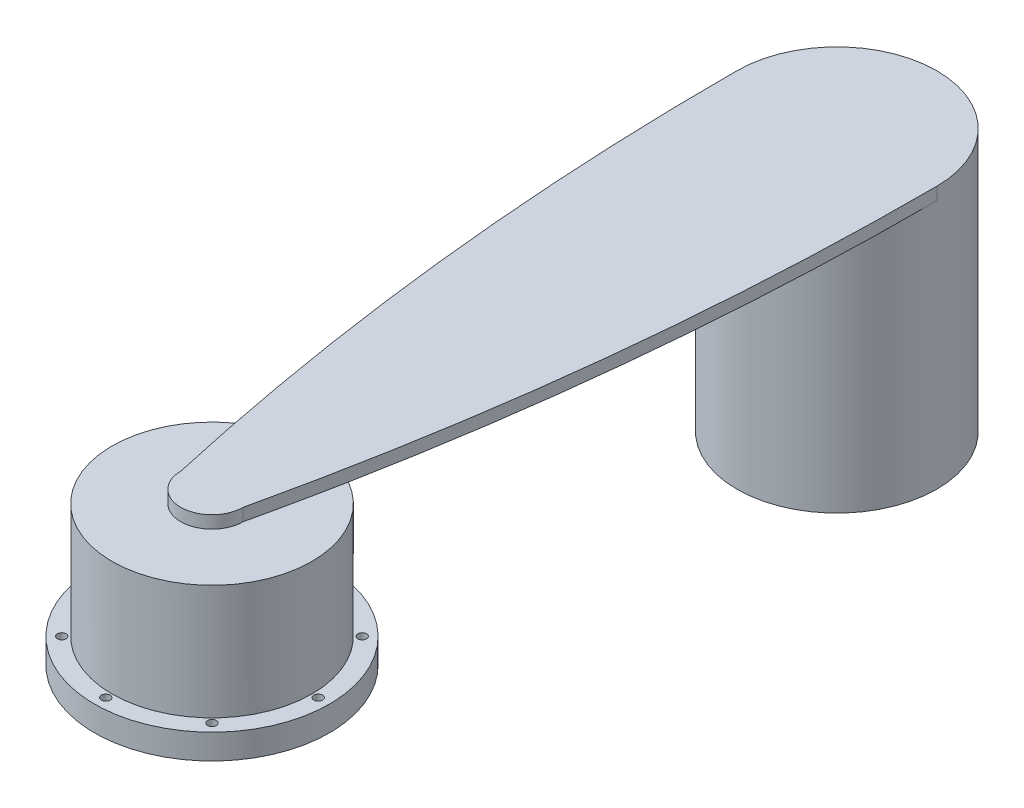
from build123d import *
from build123d.topology import SkipClean

# Parameters (mm, degrees)
SKETCH_1_R          = 40
EXTRUDE_1_DEPTH     = 50
EXTRUDE_1_2_DEPTH   = 50
EXTRUDE_START       = 5
EXTRUDE_2_DEPTH     = 5
EXTRUDE_3_DEPTH     = 5
EXTRUDE_START_2     = -5
SKETCH_5_R          = 40
EXTRUDE_4_DEPTH     = 5
SKETCH_7_R          = 2
SKETCH_7_R_2        = 4
CUT_EXTRUDE_2_DEPTH = 10
CUT_EXTRUDE_START   = -59.05
SKETCH_9_R          = 40
CUT_EXTRUDE_4_DEPTH = 54.05
SKETCH_10_R         = 47
EXTRUDE_5_DEPTH     = 10
CUT_EXTRUDE_5_REACH = 302.04
SKETCH_11_R         = 1.75
CUT_EXTRUDE_START_2 = -80
SKETCH_12_R         = 39.999999969
CUT_EXTRUDE_6_DEPTH = 20
SKETCH_14_R         = 40
EXTRUDE_6_DEPTH     = 5
CUT_EXTRUDE_8_DEPTH = 10
CUT_EXTRUDE_9_DEPTH = 5
EXTRUDE_8_DEPTH     = 5
SKETCH_13_R         = 39.999999969
SKETCH_13_R_2       = 29.999999969
EXTRUDE_1_3_DEPTH   = 25


with BuildPart() as part:
    # 草图1 → Extrude 1 (new, symmetric)
    with BuildSketch(Plane(origin=(0, 0, 0), x_dir=(1, 0, 0), z_dir=(0, 1, 0))):
        Circle(SKETCH_1_R)
    extrude(amount=EXTRUDE_1_DEPTH, both=True)



with BuildPart() as body_2:
    # 草图1 → Extrude 1 2 (new, symmetric)
    with BuildSketch(Plane(origin=(0, 0, 0), x_dir=(1, 0, 0), z_dir=(0, 1, 0))):
        with Locations((0, 250)):
            Circle(SKETCH_1_R)
    extrude(amount=EXTRUDE_1_2_DEPTH, both=True)


with BuildPart() as part_1:
    add(part.part)

    add(body_2.part)  # 凸台-拉伸2 merges body 2
    # 草图2 → 凸台-拉伸2 (add)
    with BuildSketch(Plane(origin=(0, 50, 0), x_dir=(1, 0, 0), z_dir=(0, 1, 0)).offset(EXTRUDE_START)):
        with BuildLine():
            Line((39.986095464, -1.054594484), (40, 250))
            ThreePointArc((40, 250), (0, 290), (-40, 250))
            Line((-40, 250), (-40, 0))
            ThreePointArc((-40, 0), (-0.527343072, -39.996523715), (39.986095464, -1.054594484))
        make_face()
    extrude(amount=-EXTRUDE_2_DEPTH)

    # 草图3 → 凸台-拉伸3 (add)
    with SkipClean():  # the faces are left unmerged after this step: merging them gives an invalid solid
        with BuildSketch(Plane(origin=(0, -50, 0), x_dir=(-1, 0, 0), z_dir=(0, -1, 0))):
            with BuildLine():
                Line((40, 0), (40, 250))
                ThreePointArc((40, 250), (0, 290), (-40, 250))
                Line((-40, 250), (-40, 0))
                ThreePointArc((-40, 0), (0, -40), (40, 0))
            make_face()
        extrude(amount=EXTRUDE_3_DEPTH)

    # 草图5 → 凸台-拉伸4 (add)
    with SkipClean():  # the faces are left unmerged after this step: merging them gives an invalid solid
        with BuildSketch(Plane.XZ.offset(55).offset(EXTRUDE_START_2)):
            Circle(SKETCH_5_R)
        extrude(amount=EXTRUDE_4_DEPTH)

    # 草图7 → 切除-拉伸2 (cut)
    with SkipClean():  # the faces are left unmerged after this step: merging them gives an invalid solid
        with BuildSketch(Plane.XZ.offset(55)):
            with Locations((17.25, -250)):
                Circle(SKETCH_7_R)
            with Locations((8.625, -264.938938215)):
                Circle(SKETCH_7_R)
            with Locations((-8.625, -264.938938215)):
                Circle(SKETCH_7_R)
            with Locations((-17.25, -250)):
                Circle(SKETCH_7_R)
            with Locations((-8.625, -235.061061785)):
                Circle(SKETCH_7_R)
            with Locations((8.625, -235.061061785)):
                Circle(SKETCH_7_R)
            with Locations((0, -250)):
                Circle(SKETCH_7_R_2)
        extrude(amount=-CUT_EXTRUDE_2_DEPTH, mode=Mode.SUBTRACT)

    # 草图9 → 切除-拉伸4 (cut)
    with SkipClean():  # the faces are left unmerged after this step: merging them gives an invalid solid
        with BuildSketch(Plane.XZ.offset(55).offset(CUT_EXTRUDE_START)):
            Circle(SKETCH_9_R)
        extrude(amount=CUT_EXTRUDE_4_DEPTH, mode=Mode.SUBTRACT)

    # 草图10 → 凸台-拉伸5 (add)
    with SkipClean():  # the faces are left unmerged after this step: merging them gives an invalid solid
        with BuildSketch(Plane.XZ.offset(-4.05)):
            Circle(SKETCH_10_R)
        extrude(amount=EXTRUDE_5_DEPTH)

    # 草图11 → 切除-拉伸5 (cut, up to next)
    with BuildSketch(Plane.XZ.offset(5.95), mode=Mode.PRIVATE) as cut_extrude_5_sk1:
        with Locations((42.5, 0)):
            Circle(SKETCH_11_R)
    cut_extrude_5_tool1 = extrude(cut_extrude_5_sk1.sketch, amount=-CUT_EXTRUDE_5_REACH, mode=Mode.PRIVATE) & part_1.part
    # 草图11 → 切除-拉伸5 (cut, up to next)
    with BuildSketch(Plane.XZ.offset(5.95), mode=Mode.PRIVATE) as cut_extrude_5_sk2:
        with Locations((30.0520382, -30.0520382)):
            Circle(SKETCH_11_R)
    cut_extrude_5_tool2 = extrude(cut_extrude_5_sk2.sketch, amount=-CUT_EXTRUDE_5_REACH, mode=Mode.PRIVATE) & part_1.part
    # 草图11 → 切除-拉伸5 (cut, up to next)
    with BuildSketch(Plane.XZ.offset(5.95), mode=Mode.PRIVATE) as cut_extrude_5_sk3:
        with Locations((0, -42.5)):
            Circle(SKETCH_11_R)
    cut_extrude_5_tool3 = extrude(cut_extrude_5_sk3.sketch, amount=-CUT_EXTRUDE_5_REACH, mode=Mode.PRIVATE) & part_1.part
    # 草图11 → 切除-拉伸5 (cut, up to next)
    with BuildSketch(Plane.XZ.offset(5.95), mode=Mode.PRIVATE) as cut_extrude_5_sk4:
        with Locations((-30.0520382, -30.0520382)):
            Circle(SKETCH_11_R)
    cut_extrude_5_tool4 = extrude(cut_extrude_5_sk4.sketch, amount=-CUT_EXTRUDE_5_REACH, mode=Mode.PRIVATE) & part_1.part
    # 草图11 → 切除-拉伸5 (cut, up to next)
    with BuildSketch(Plane.XZ.offset(5.95), mode=Mode.PRIVATE) as cut_extrude_5_sk5:
        with Locations((-42.5, 0)):
            Circle(SKETCH_11_R)
    cut_extrude_5_tool5 = extrude(cut_extrude_5_sk5.sketch, amount=-CUT_EXTRUDE_5_REACH, mode=Mode.PRIVATE) & part_1.part
    # 草图11 → 切除-拉伸5 (cut, up to next)
    with BuildSketch(Plane.XZ.offset(5.95), mode=Mode.PRIVATE) as cut_extrude_5_sk6:
        with Locations((-30.0520382, 30.0520382)):
            Circle(SKETCH_11_R)
    cut_extrude_5_tool6 = extrude(cut_extrude_5_sk6.sketch, amount=-CUT_EXTRUDE_5_REACH, mode=Mode.PRIVATE) & part_1.part
    # 草图11 → 切除-拉伸5 (cut, up to next)
    with BuildSketch(Plane.XZ.offset(5.95), mode=Mode.PRIVATE) as cut_extrude_5_sk7:
        with Locations((0, 42.5)):
            Circle(SKETCH_11_R)
    cut_extrude_5_tool7 = extrude(cut_extrude_5_sk7.sketch, amount=-CUT_EXTRUDE_5_REACH, mode=Mode.PRIVATE) & part_1.part
    # 草图11 → 切除-拉伸5 (cut, up to next)
    with BuildSketch(Plane.XZ.offset(5.95), mode=Mode.PRIVATE) as cut_extrude_5_sk8:
        with Locations((30.0520382, 30.0520382)):
            Circle(SKETCH_11_R)
    cut_extrude_5_tool8 = extrude(cut_extrude_5_sk8.sketch, amount=-CUT_EXTRUDE_5_REACH, mode=Mode.PRIVATE) & part_1.part
    add(cut_extrude_5_tool1.solids().sort_by_distance((42.5, -5.95, 0))[0], mode=Mode.SUBTRACT)
    add(cut_extrude_5_tool2.solids().sort_by_distance((30.052038, -5.95, -30.052038))[0], mode=Mode.SUBTRACT)
    add(cut_extrude_5_tool3.solids().sort_by_distance((0, -5.95, -42.5))[0], mode=Mode.SUBTRACT)
    add(cut_extrude_5_tool4.solids().sort_by_distance((-30.052038, -5.95, -30.052038))[0], mode=Mode.SUBTRACT)
    add(cut_extrude_5_tool5.solids().sort_by_distance((-42.5, -5.95, 0))[0], mode=Mode.SUBTRACT)
    add(cut_extrude_5_tool6.solids().sort_by_distance((-30.052038, -5.95, 30.052038))[0], mode=Mode.SUBTRACT)
    add(cut_extrude_5_tool7.solids().sort_by_distance((0, -5.95, 42.5))[0], mode=Mode.SUBTRACT)
    add(cut_extrude_5_tool8.solids().sort_by_distance((30.052038, -5.95, 30.052038))[0], mode=Mode.SUBTRACT)

    # 草图12 → 切除-拉伸6 (cut)
    with SkipClean():  # the faces are left unmerged after this step: merging them gives an invalid solid
        with BuildSketch(Plane(origin=(0, 55, 0), x_dir=(1, 0, 0), z_dir=(0, 1, 0)).offset(CUT_EXTRUDE_START_2)):
            with Locations((0, 250)):
                Circle(SKETCH_12_R)
        extrude(amount=-CUT_EXTRUDE_6_DEPTH, mode=Mode.SUBTRACT)


with BuildPart() as cut_extrude_6_piece_1:
    # of the separate pieces the step leaves, piece 1, a body of its own (cut_extrude_6_pieces)
    add(part_1.part.solids().sort_by_distance((47, 4.05, 0))[0])

    # 草图14 → 凸台-拉伸6 (add)
    with BuildSketch(Plane.XZ.offset(-50)):
        with Locations((0, -250)):
            Circle(SKETCH_14_R)
    extrude(amount=-EXTRUDE_6_DEPTH)

    # 草图17 → 切除-拉伸9 (cut)
    with BuildSketch(Plane(origin=(0, 55, 0), x_dir=(1, 0, 0), z_dir=(0, 1, 0))):
        with BuildLine():
            Line((-40, 0), (-40, 250))
            ThreePointArc((-40, 250), (0, 290), (40, 250))
            Line((40, 250), (40, 0))
            ThreePointArc((40, 0), (0, -40), (-40, 0))
        make_face()
    extrude(amount=-CUT_EXTRUDE_9_DEPTH, mode=Mode.SUBTRACT)


with BuildPart() as cut_extrude_6_piece_2:
    # of the separate pieces the step leaves, piece 2, a body of its own (cut_extrude_6_pieces)
    add(part_1.part.solids().sort_by_distance((39.999999969, -45, -250))[0])

    # 草图15 → 切除-拉伸8 (cut)
    with BuildSketch(Plane.XZ.offset(55)):
        with BuildLine():
            Line((40, 0), (40, -250))
            ThreePointArc((40, -250), (0, -290), (-40, -250))
            Line((-40, -250), (-40, 0))
            ThreePointArc((-40, 0), (0, 40), (40, 0))
        make_face()
    extrude(amount=-CUT_EXTRUDE_8_DEPTH, mode=Mode.SUBTRACT)


with BuildPart() as cut_extrude_9_piece_1:
    # of the separate pieces the step leaves, piece 1, a body of its own (cut_extrude_9_pieces)
    add(cut_extrude_6_piece_1.part.solids().sort_by_distance((40, 50, -250))[0])



with BuildPart() as cut_extrude_9_piece_2:
    # of the separate pieces the step leaves, piece 2, a body of its own (cut_extrude_9_pieces)
    add(cut_extrude_6_piece_1.part.solids().sort_by_distance((47, 4.05, 0))[0])


with BuildPart() as cut_extrude_9_piece_1_1:
    add(cut_extrude_9_piece_1.part)

    add(cut_extrude_9_piece_2.part)  # 凸台-拉伸8 merges 切除-拉伸9 piece 2
    # 草图18 → 凸台-拉伸8 (add)
    with BuildSketch(Plane(origin=(0, 55, 0), x_dir=(1, 0, 0), z_dir=(0, 1, 0))):
        with BuildLine():
            ThreePointArc((40.000000061, 250), (0, 290.000000061), (-40.000000061, 250))
            ThreePointArc((-40.000000061, 250), (-33.286999063, 124.225930105), (-12.5, 0))
            ThreePointArc((-12.5, 0), (0, -12.5), (12.5, 0))
            ThreePointArc((12.5, 0), (33.286999063, 124.225930105), (40.000000061, 250))
        make_face()
    extrude(amount=-EXTRUDE_8_DEPTH)

    # 草图13 → Extrude 1 3 (add)
    with BuildSketch(Plane.XZ.offset(25)):
        with Locations((0, -250)):
            Circle(SKETCH_13_R)
        with Locations((0, -250)):
            Circle(SKETCH_13_R_2, mode=Mode.SUBTRACT)
    extrude(amount=EXTRUDE_1_3_DEPTH)


solid = cut_extrude_9_piece_1_1.part
